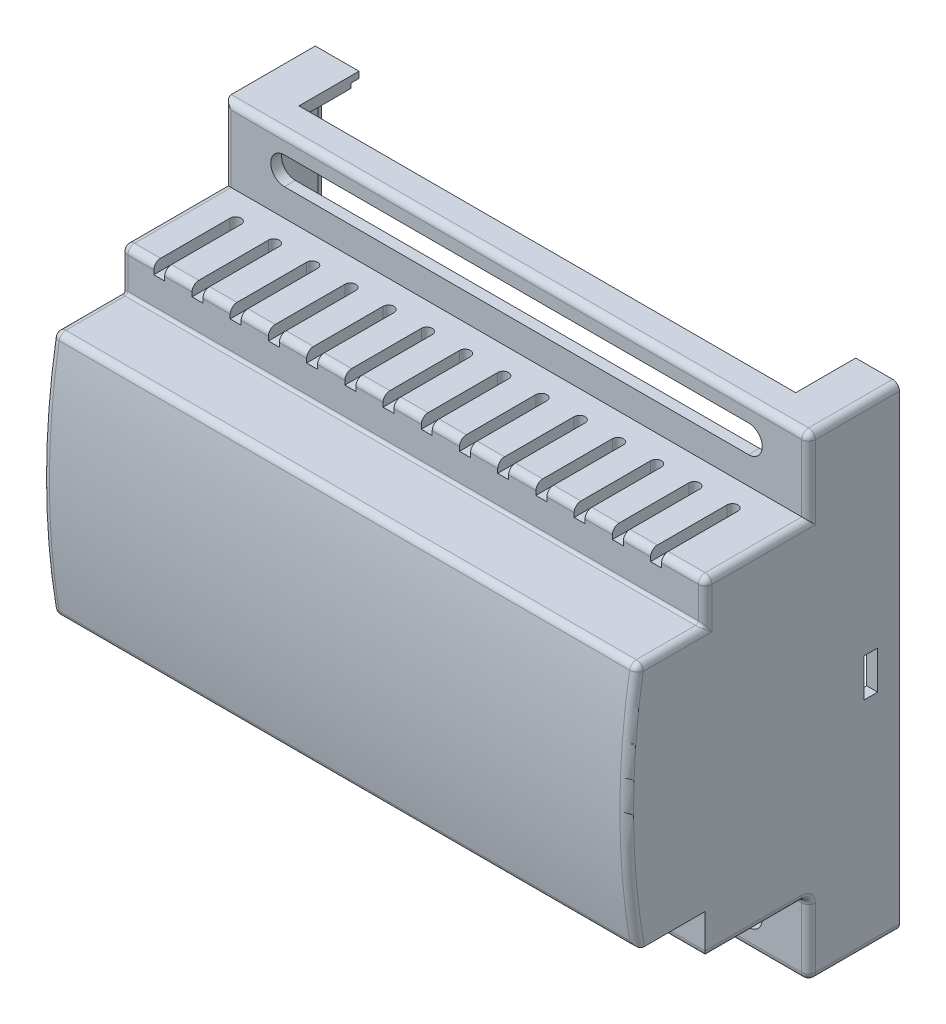
from build123d import *

# Parameters (mm, degrees)
BOSS_EXTRUDE3_DEPTH = 107
SHELL3_T            = -2
FILLET3_R           = 1.25
SKETCH5_W           = 2.5
SKETCH5_H           = 7
CUT_EXTRUDE3_DEPTH  = 126.849101051
SKETCH6_W           = 91
SKETCH6_H           = 22
CUT_EXTRUDE4_DEPTH  = 147.679058685
CUT_EXTRUDE5_DEPTH  = 3
FILLET4_R           = 0.5
CUT_EXTRUDE7_DEPTH  = 2
SKETCH10_W          = 104.7
SKETCH10_H          = 84.7
CUT_EXTRUDE8_DEPTH  = 1.5
FILLET5_R           = 0.5


with BuildPart() as part:
    # Sketch1 → Boss-Extrude3 (new body)
    with BuildSketch(Plane(origin=(0, 0, 0), x_dir=(0, 0, -1), z_dir=(1, 0, 0))):
        with BuildLine():
            Line((0, -43.5), (0, 43.5))
            Line((0, 43.5), (-16.65, 43.5))
            Line((-16.65, 43.5), (-16.65, 30))
            Line((-16.65, 30), (-35.59, 30))
            Line((-35.59, 30), (-35.59, 22.5))
            Line((-35.59, 22.5), (-48, 22.5))
            ThreePointArc((-48, 22.5), (-49.967451659, 0), (-48, -22.5))
            Line((-48, -22.5), (-35.59, -22.5))
            Line((-35.59, -22.5), (-35.59, -30))
            Line((-35.59, -30), (-16.65, -30))
            Line((-16.65, -30), (-16.65, -43.5))
            Line((-16.65, -43.5), (0, -43.5))
        make_face()
    extrude(amount=BOSS_EXTRUDE3_DEPTH)

    # Shell3
    shell3_openings = [part.faces().sort_by_distance(p)[0] for p in [
        (53.5, 0, 0),
    ]]
    offset(amount=SHELL3_T, openings=shell3_openings, kind=Kind.INTERSECTION)

    # Fillet3
    fillet3_edges = [part.edges().sort_by_distance(p)[0] for p in [
        (107, 0, 49.967451659),
        (53.5, -22.5, 48),
        (0, 0, 49.967451659),
        (53.5, 22.5, 48),
        (107, -36.75, 16.65),
        (0, -36.75, 16.65),
        (53.5, -30, 35.59),
        (107, -30, 26.12),
        (53.5, -30, 16.65),
        (0, -30, 26.12),
        (0, -26.25, 35.59),
        (0, -22.5, 41.795),
        (0, 22.5, 41.795),
        (0, 26.25, 35.59),
        (0, 30, 26.12),
        (0, 36.75, 16.65),
        (53.5, 43.5, 16.65),
        (107, 43.5, 8.325),
        (107, 36.75, 16.65),
        (107, 30, 26.12),
        (53.5, 30, 35.59),
        (107, 26.25, 35.59),
        (107, 22.5, 41.795),
        (0, -43.5, 8.325),
        (107, -43.5, 8.325),
        (53.5, -43.5, 16.65),
    ]]
    fillet(fillet3_edges, radius=FILLET3_R)

    # Sketch5 → Cut-Extrude3 (cut, through all)
    with BuildSketch(Plane(origin=(107, 0, 0), x_dir=(0, 0, -1), z_dir=(1, 0, 0))):
        with Locations((-5.25, 0)):
            Rectangle(SKETCH5_W, SKETCH5_H)
    extrude(amount=-CUT_EXTRUDE3_DEPTH, mode=Mode.SUBTRACT)

    # Sketch6 → Cut-Extrude4 (cut, through all)
    with BuildSketch(Plane.XZ.offset(43.5)):
        with Locations((53.5, 0)):
            Rectangle(SKETCH6_W, SKETCH6_H)
    extrude(amount=-CUT_EXTRUDE4_DEPTH, mode=Mode.SUBTRACT)

    # Sketch7 → Cut-Extrude5 (cut)
    with BuildSketch(Plane.XY.offset(16.65)):
        with BuildLine():
            Line((11, -35), (96, -35))
            ThreePointArc((96, -35), (98.5, -37.5), (96, -40))
            Line((96, -40), (11, -40))
            ThreePointArc((11, -40), (8.5, -37.5), (11, -35))
        make_face()
        with BuildLine():
            Line((96, 35), (11, 35))
            ThreePointArc((11, 35), (8.48, 37.52), (11, 40.04))
            Line((11, 40.04), (96, 40.04))
            ThreePointArc((96, 40.04), (98.52, 37.52), (96, 35))
        make_face()
    extrude(amount=-CUT_EXTRUDE5_DEPTH, mode=Mode.SUBTRACT)

    # Fillet4
    fillet4_edges = [part.edges().sort_by_distance(p)[0] for p in [
        (106.633883476, 22.133883476, 35.223883476),
        (0.366116524, 22.133883476, 35.223883476),
        (2, 41.5, 7.325),
        (2, 34.75, 14.65),
        (2, 28, 24.12),
        (53.5, 28, 14.65),
        (2, 24.25, 33.59),
        (53.5, 28, 33.59),
        (2, 20.5, 39.9502324),
        (2, 0, 47.967451659),
        (53.5, 20.5, 46.310464799),
        (2, -20.5, 39.9502324),
        (53.5, -20.5, 46.310464799),
        (2, -24.25, 33.59),
        (53.5, -20.5, 33.59),
        (2, -28, 24.12),
        (53.5, -28, 33.59),
        (2, -34.75, 14.65),
        (53.5, -28, 14.65),
        (105, 41.5, 7.325),
        (105, 34.75, 14.65),
        (105, 28, 24.12),
        (105, 24.25, 33.59),
        (105, 20.5, 39.9502324),
        (105, 0, 47.967451659),
        (105, -20.5, 39.9502324),
        (105, -24.25, 33.59),
        (105, -28, 24.12),
        (105, -34.75, 14.65),
        (53.5, 22.5, 35.59),
    ]]
    fillet(fillet4_edges, radius=FILLET4_R - 0.0001)  # a hair under: the kernel refuses the full size

    # Sketch8 → Cut-Extrude7 (cut)
    with BuildSketch(Plane.XZ.offset(30)):
        with BuildLine():
            Line((6, 35.59), (8, 35.59))
            Line((8, 35.59), (8, 21.59))
            ThreePointArc((8, 21.59), (7, 20.59), (6, 21.59))
            Line((6, 21.59), (6, 35.59))
        make_face()
        with BuildLine():
            Line((13, 35.59), (13, 21.59))
            ThreePointArc((13, 21.59), (14, 20.59), (15, 21.59))
            Line((15, 21.59), (15, 35.59))
            Line((15, 35.59), (13, 35.59))
        make_face()
        with BuildLine():
            Line((20, 35.59), (20, 21.59))
            ThreePointArc((20, 21.59), (21, 20.59), (22, 21.59))
            Line((22, 21.59), (22, 35.59))
            Line((22, 35.59), (20, 35.59))
        make_face()
        with BuildLine():
            Line((27, 35.59), (27, 21.59))
            ThreePointArc((27, 21.59), (28, 20.59), (29, 21.59))
            Line((29, 21.59), (29, 35.59))
            Line((29, 35.59), (27, 35.59))
        make_face()
        with BuildLine():
            Line((34, 35.59), (34, 21.59))
            ThreePointArc((34, 21.59), (35, 20.59), (36, 21.59))
            Line((36, 21.59), (36, 35.59))
            Line((36, 35.59), (34, 35.59))
        make_face()
        with BuildLine():
            Line((41, 35.59), (41, 21.59))
            ThreePointArc((41, 21.59), (42, 20.59), (43, 21.59))
            Line((43, 21.59), (43, 35.59))
            Line((43, 35.59), (41, 35.59))
        make_face()
        with BuildLine():
            Line((48, 35.59), (48, 21.59))
            ThreePointArc((48, 21.59), (49, 20.59), (50, 21.59))
            Line((50, 21.59), (50, 35.59))
            Line((50, 35.59), (48, 35.59))
        make_face()
        with BuildLine():
            Line((55, 35.59), (55, 21.59))
            ThreePointArc((55, 21.59), (56, 20.59), (57, 21.59))
            Line((57, 21.59), (57, 35.59))
            Line((57, 35.59), (55, 35.59))
        make_face()
        with BuildLine():
            Line((62, 35.59), (62, 21.59))
            ThreePointArc((62, 21.59), (63, 20.59), (64, 21.59))
            Line((64, 21.59), (64, 35.59))
            Line((64, 35.59), (62, 35.59))
        make_face()
        with BuildLine():
            Line((69, 35.59), (69, 21.59))
            ThreePointArc((69, 21.59), (70, 20.59), (71, 21.59))
            Line((71, 21.59), (71, 35.59))
            Line((71, 35.59), (69, 35.59))
        make_face()
        with BuildLine():
            Line((76, 35.59), (76, 21.59))
            ThreePointArc((76, 21.59), (77, 20.59), (78, 21.59))
            Line((78, 21.59), (78, 35.59))
            Line((78, 35.59), (76, 35.59))
        make_face()
        with BuildLine():
            Line((83, 35.59), (83, 21.59))
            ThreePointArc((83, 21.59), (84, 20.59), (85, 21.59))
            Line((85, 21.59), (85, 35.59))
            Line((85, 35.59), (83, 35.59))
        make_face()
        with BuildLine():
            Line((90, 35.59), (90, 21.59))
            ThreePointArc((90, 21.59), (91, 20.59), (92, 21.59))
            Line((92, 21.59), (92, 35.59))
            Line((92, 35.59), (90, 35.59))
        make_face()
        with BuildLine():
            Line((97, 35.59), (97, 21.59))
            ThreePointArc((97, 21.59), (98, 20.59), (99, 21.59))
            Line((99, 21.59), (99, 35.59))
            Line((99, 35.59), (97, 35.59))
        make_face()
    cut_extrude7 = extrude(amount=-CUT_EXTRUDE7_DEPTH, mode=Mode.SUBTRACT)

    # Mirror1: Cut-Extrude7 across plane
    add(cut_extrude7.mirror(Plane.ZX), mode=Mode.SUBTRACT)

    # Sketch10 → Cut-Extrude8 (cut)
    with BuildSketch(Plane(origin=(0, 0, 0), x_dir=(-1, 0, 0), z_dir=(0, 0, -1))):
        with Locations((-53.5, 0)):
            Rectangle(SKETCH10_W, SKETCH10_H)
    extrude(amount=-CUT_EXTRUDE8_DEPTH, mode=Mode.SUBTRACT)

    # Fillet5
    fillet5_edges = [part.edges().sort_by_distance(p)[0] for p in [
        (2, -41.5, 7.82505),
        (53.5, -41.5, 14.65),
        (105, -41.5, 7.82505),
        (104.85358268, -41.5, 14.50358268),
        (2.14641732, -41.5, 14.50358268),
        (1.15, -42.35, 0.75),
        (105.85, -42.35, 0.75),
    ]]
    fillet(fillet5_edges, radius=FILLET5_R - 0.0001)  # a hair under: the kernel refuses the full size


solid = part.part
